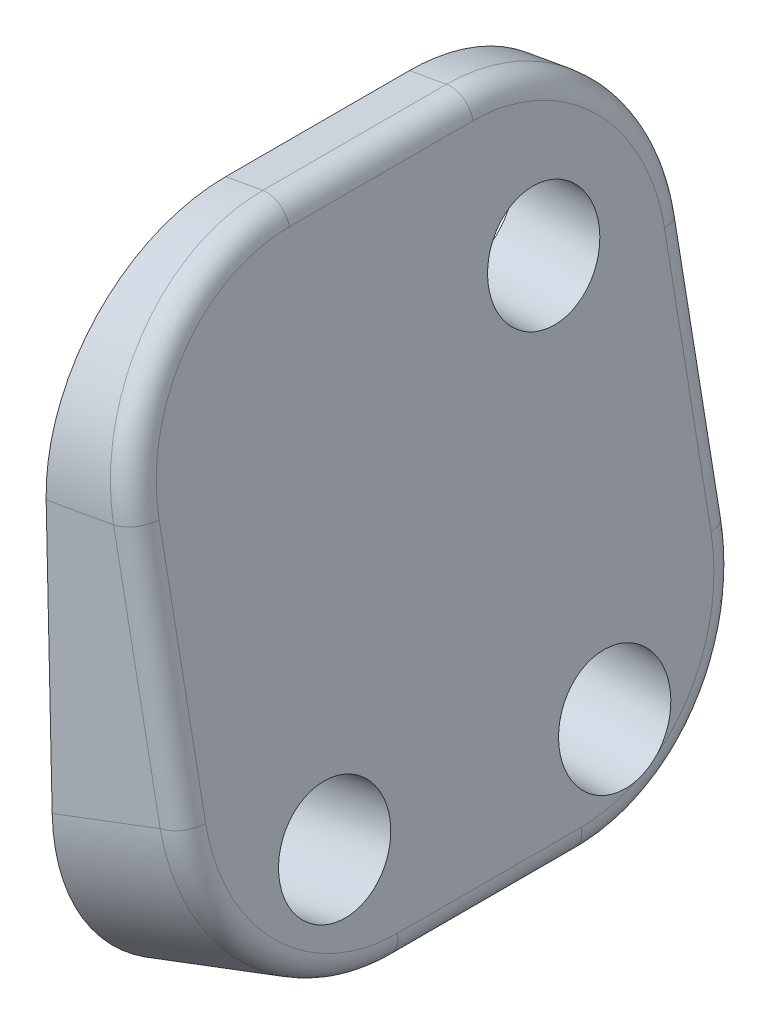
from build123d import *

# Parameters (mm, degrees)
BOSS_EXTRUDE1_DEPTH = 9.525
SKETCH6_R           = 1.905
CUT_EXTRUDE2_DEPTH  = 24.57584049
SKETCH8_R           = 1.905
CUT_EXTRUDE3_DEPTH  = 24.578696193
FILLET1_R           = 6.35
FILLET2_R           = 0.79375


with BuildPart() as part:
    # Sketch1 → Boss-Extrude1 (new, symmetric)
    with BuildSketch(Plane.XY):
        Polygon((-5.559289674, -2.102353094), (-6.062137994, 20.335927604), (-4.014716792, 20.699752948), (0, 0), align=None)
    extrude(amount=BOSS_EXTRUDE1_DEPTH, both=True)

    # Sketch6 → Cut-Extrude2 (cut, through all)
    with BuildSketch(Plane(origin=(-5.60358977, -0.125578057, 0), x_dir=(0, 0, 1), z_dir=(-0.9997489840534746, -0.022404662105137464, 0))):
        with Locations((-4.7625, 2.894685876)):
            Circle(SKETCH6_R)
        with Locations((-4.7625, 15.594685876)):
            Circle(SKETCH6_R)
    extrude(amount=-CUT_EXTRUDE2_DEPTH, mode=Mode.SUBTRACT)

    # Sketch8 → Cut-Extrude3 (cut, through all)
    with BuildSketch(Plane(origin=(0, 0, 0), x_dir=(0, 0, -1), z_dir=(0.9817062255166078, 0.19040190855644112, 0))):
        with Locations((-4.7625, 3.735486075)):
            Circle(SKETCH8_R)
    extrude(amount=-CUT_EXTRUDE3_DEPTH, mode=Mode.SUBTRACT)

    # Fillet1
    fillet1_edges = [part.edges().sort_by_distance(p)[0] for p in [
        (-2.779644837, -1.051176547, 9.525),
        (-2.779644837, -1.051176547, -9.525),
        (-5.038427393, 20.517840276, -9.525),
        (-5.038427393, 20.517840276, 9.525),
    ]]
    fillet(fillet1_edges, radius=FILLET1_R)

    # Fillet2
    fillet2_edges = [part.edges().sort_by_distance(p)[0] for p in [
        (-4.014716792, 20.699752948, 0),
        (-3.660523559, 18.873543831, -7.665266551),
        (-2.016123003, 10.395066514, -9.525),
        (-0.362454368, 1.868803269, -7.681391659),
        (0, 0, 0),
        (-0.362454368, 1.868803269, 7.681391659),
        (-2.016123003, 10.395066514, 9.525),
        (-3.660523559, 18.873543831, 7.665266551),
    ]]
    fillet(fillet2_edges, radius=FILLET2_R)


solid = part.part
